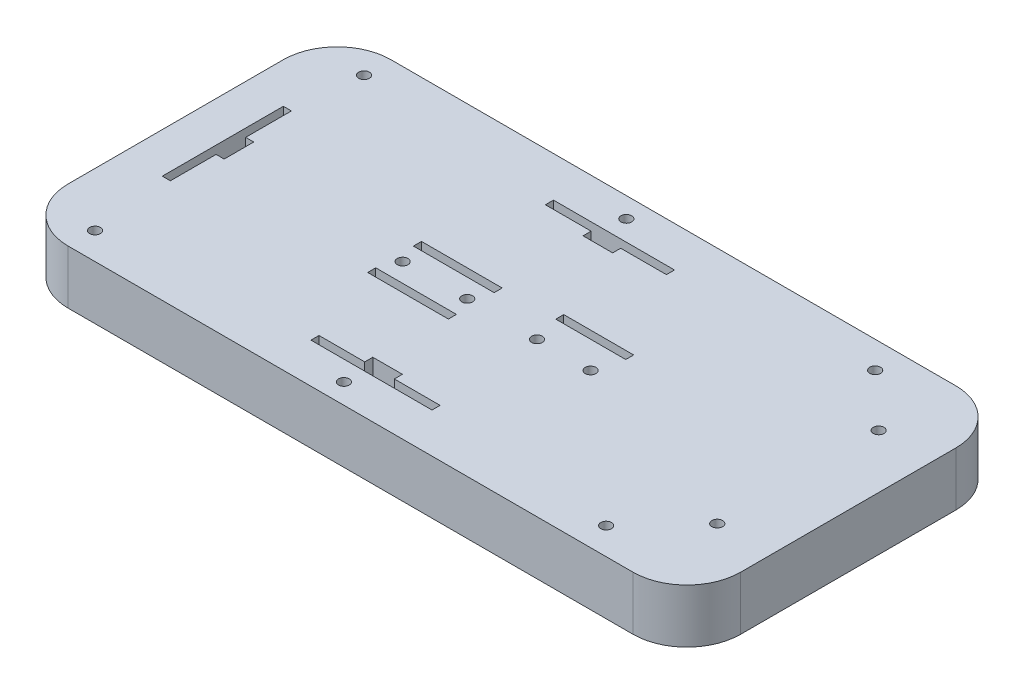
from build123d import *

# Parameters (mm, degrees)
CROQUIS1_R              = 2
CROQUIS1_W              = 26
CROQUIS1_H              = 2.944171422
CROQUIS1_W_2            = 30
CROQUIS1_H_2            = 3
SALIENTE_EXTRUIR2_DEPTH = 20
CROQUIS2_R              = 15
SALIENTE_EXTRUIR3_DEPTH = 20
CORTAR_EXTRUIR2_START   = -10
CROQUIS4_R              = 2
CROQUIS4_W              = 30
CROQUIS4_H              = 3
CORTAR_EXTRUIR2_DEPTH   = 10


with BuildPart() as part:
    # Croquis1 → Saliente-Extruir2 (new body)
    with BuildSketch(Plane(origin=(0, 0, 0), x_dir=(1, 0, 0), z_dir=(0, 1, 0))):
        with BuildLine():
            Line((20, 0), (230, 0))
            ThreePointArc((230, 0), (244.142135624, 5.857864376), (250, 20))
            Line((250, 20), (250, 100))
            ThreePointArc((250, 100), (244.142135624, 114.142135624), (230, 120))
            Line((230, 120), (20, 120))
            ThreePointArc((20, 120), (5.857864376, 114.142135624), (0, 100))
            Line((0, 100), (0, 20))
            ThreePointArc((0, 20), (5.857864376, 5.857864376), (20, 0))
        make_face()
        with Locations((115, 112.5)):
            Circle(CROQUIS1_R, mode=Mode.SUBTRACT)
        with Locations((115, 7.5)):
            Circle(CROQUIS1_R, mode=Mode.SUBTRACT)
        with Locations((20, 110)):
            Circle(CROQUIS1_R, mode=Mode.SUBTRACT)
        with Locations((20, 10)):
            Circle(CROQUIS1_R, mode=Mode.SUBTRACT)
        with Locations((210, 110)):
            Circle(CROQUIS1_R, mode=Mode.SUBTRACT)
        with Locations((210, 10)):
            Circle(CROQUIS1_R, mode=Mode.SUBTRACT)
        with Locations((230, 31.303267232)):
            Circle(CROQUIS1_R, mode=Mode.SUBTRACT)
        with Locations((230, 91.303267232)):
            Circle(CROQUIS1_R, mode=Mode.SUBTRACT)
        with Locations((87.177665307, 57.171940588)):
            Circle(CROQUIS1_R, mode=Mode.SUBTRACT)
        with Locations((111.177665307, 57.171940588)):
            Circle(CROQUIS1_R, mode=Mode.SUBTRACT)
        with Locations((137.177756507, 57.112494883)):
            Circle(CROQUIS1_R, mode=Mode.SUBTRACT)
        with Locations((157.177665307, 57.052096121)):
            Circle(CROQUIS1_R, mode=Mode.SUBTRACT)
        Polygon((123.413193564, 17.842204256), (140.413193564, 17.842204256), (140.413193564, 14.842204256), (95.413193564, 14.842204256), (95.413193564, 17.842204256), (112.413193564, 17.842204256), (112.413193564, 20.842204256), (123.413193564, 20.842204256), align=None, mode=Mode.SUBTRACT)
        Polygon((15, 85), (18, 85), (18, 68), (21, 68), (21, 57), (18, 57), (18, 40), (15, 40), align=None, mode=Mode.SUBTRACT)
        Polygon((95.413193564, 102), (112.413193564, 102), (112.413193564, 99), (123.413193564, 99), (123.413193564, 102), (140.413193564, 102), (140.413193564, 105), (95.413193564, 105), align=None, mode=Mode.SUBTRACT)
        with Locations((147.177665307, 68.580971349)):
            Rectangle(CROQUIS1_W, CROQUIS1_H, mode=Mode.SUBTRACT)
        with Locations((99.177665307, 65.671940588)):
            Rectangle(CROQUIS1_W_2, CROQUIS1_H_2, mode=Mode.SUBTRACT)
        with Locations((99.177665307, 48.671940588)):
            Rectangle(CROQUIS1_W_2, CROQUIS1_H_2, mode=Mode.SUBTRACT)
    extrude(amount=SALIENTE_EXTRUIR2_DEPTH)

    # Croquis2 → Saliente-Extruir3 (add)
    with BuildSketch(Plane(origin=(0, 20, 0), x_dir=(1, 0, 0), z_dir=(0, 1, 0))):
        with Locations((115, 60)):
            Circle(CROQUIS2_R)
    extrude(amount=-SALIENTE_EXTRUIR3_DEPTH)

    # Croquis4 → Cortar-Extruir2 (cut)
    with BuildSketch(Plane(origin=(0, 20, 0), x_dir=(1, 0, 0), z_dir=(0, 1, 0)).offset(CORTAR_EXTRUIR2_START)):
        with Locations((111.177665307, 57.171940588)):
            Circle(CROQUIS4_R)
        with Locations((87.177665307, 57.171940588)):
            Circle(CROQUIS4_R)
        with Locations((99.177665307, 65.671940588)):
            Rectangle(CROQUIS4_W, CROQUIS4_H)
        with Locations((99.177665307, 48.671940588)):
            Rectangle(CROQUIS4_W, CROQUIS4_H)
    extrude(amount=CORTAR_EXTRUIR2_DEPTH, mode=Mode.SUBTRACT)


solid = part.part
